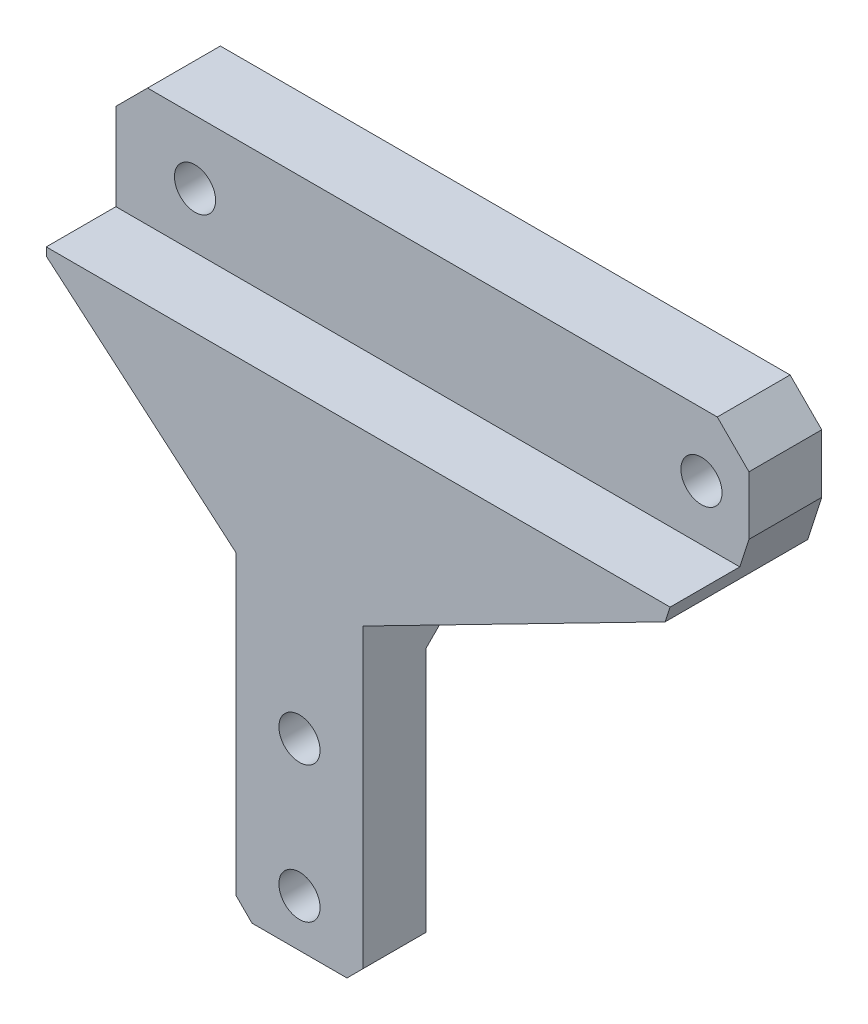
from build123d import *

# Parameters (mm, degrees)
SKETCH_1_R          = 0.65
EXTRUDE_2_DEPTH     = 5.5
SKETCH_3_W          = 4
SKETCH_3_H          = 9.274823913
SKETCH_3_R          = 0.65
CUT_EXTRUDE_2_DEPTH = 3.5
CHAMFER_1_SIZE      = 1
CHAMFER_2_SIZE      = 1
CHAMFER_3_SIZE      = 0.5
CUT_EXTRUDE_START   = -2.2
SKETCH_4_R          = 0.65
CUT_EXTRUDE_3_DEPTH = 2.2
CHAMFER_4_SIZE      = 0.5
CHAMFER_4_SIZE2     = 1.151153621
SKETCH_5_R          = 0.65
CUT_EXTRUDE_4_DEPTH = 1


with BuildPart() as part:
    # 草图1 → 凸台-拉伸2 (new body)
    with BuildSketch(Plane.XY):
        Polygon((-10, 2), (10, 2), (10, -2), (0, -7.120268706), (0, -17), (-4, -17), (-4, -7.120268706), (-10, -2), align=None)
        with Locations((-7.5, 0)):
            Circle(SKETCH_1_R, mode=Mode.SUBTRACT)
        with Locations((8.5, 0)):
            Circle(SKETCH_1_R, mode=Mode.SUBTRACT)
        with Locations((-2, -15.5)):
            Circle(SKETCH_1_R, mode=Mode.SUBTRACT)
        with Locations((-2, -11.2)):
            Circle(SKETCH_1_R, mode=Mode.SUBTRACT)
    extrude(amount=EXTRUDE_2_DEPTH)

    # 草图3 → 切除-拉伸2 (cut)
    with BuildSketch(Plane(origin=(0, 0, 0), x_dir=(-1, 0, 0), z_dir=(0, 0, -1))):
        with Locations((2, -12.362588044)):
            Rectangle(SKETCH_3_W, SKETCH_3_H)
        with Locations((2, -15.5)):
            Circle(SKETCH_3_R, mode=Mode.SUBTRACT)
        with Locations((2, -11.2)):
            Circle(SKETCH_3_R, mode=Mode.SUBTRACT)
    extrude(amount=-CUT_EXTRUDE_2_DEPTH, mode=Mode.SUBTRACT)

    # 倒角1
    chamfer_1_edges = [part.edges().sort_by_distance(p)[0] for p in [
        (-2, -7.725176087, 3.5),
    ]]
    chamfer(chamfer_1_edges, length=CHAMFER_1_SIZE)

    # 倒角2
    chamfer_2_edges = [part.edges().sort_by_distance(p)[0] for p in [
        (-10, 2, 2.75),
        (10, 2, 2.75),
    ]]
    chamfer(chamfer_2_edges, length=CHAMFER_2_SIZE)

    # 倒角3
    chamfer_3_edges = [part.edges().sort_by_distance(p)[0] for p in [
        (-4, -17, 4.5),
        (0, -17, 4.5),
    ]]
    chamfer(chamfer_3_edges, length=CHAMFER_3_SIZE)

    # 草图4 → 切除-拉伸3 (cut)
    with BuildSketch(Plane.XY.offset(5.5).offset(CUT_EXTRUDE_START)):
        Polygon((-10, -1.746172146), (10, -1.746172146), (10, 1), (9, 2), (-9, 2), (-10, 1), align=None)
        with Locations((8.5, 0)):
            Circle(SKETCH_4_R, mode=Mode.SUBTRACT)
        with Locations((-7.5, 0)):
            Circle(SKETCH_4_R, mode=Mode.SUBTRACT)
    extrude(amount=CUT_EXTRUDE_3_DEPTH, mode=Mode.SUBTRACT)

    # 倒角4
    chamfer_4_edges = [part.edges().sort_by_distance(p)[0] for p in [
        (10, -2, 2.75),
    ]]
    chamfer_4_side = [part.faces().sort_by_distance(p)[0] for p in [
        (5, -4.560134353, 2.75),
    ]]
    chamfer(chamfer_4_edges, length=CHAMFER_4_SIZE, length2=CHAMFER_4_SIZE2, reference=chamfer_4_side[0])

    # 草图5 → 切除-拉伸4 (cut)
    with BuildSketch(Plane(origin=(0, 0, 0), x_dir=(-1, 0, 0), z_dir=(0, 0, -1))):
        Polygon((-10, 1), (-10, -0.848846379), (-9.554947939, -2.227878614), (0, -7.120268706), (0, -7.725176087), (4, -7.725176087), (4, -7.120268706), (10, -2), (10, 1), (9, 2), (-9, 2), align=None)
        with Locations((7.5, 0)):
            Circle(SKETCH_5_R, mode=Mode.SUBTRACT)
        with Locations((-8.5, 0)):
            Circle(SKETCH_5_R, mode=Mode.SUBTRACT)
    extrude(amount=-CUT_EXTRUDE_4_DEPTH, mode=Mode.SUBTRACT)


solid = part.part
